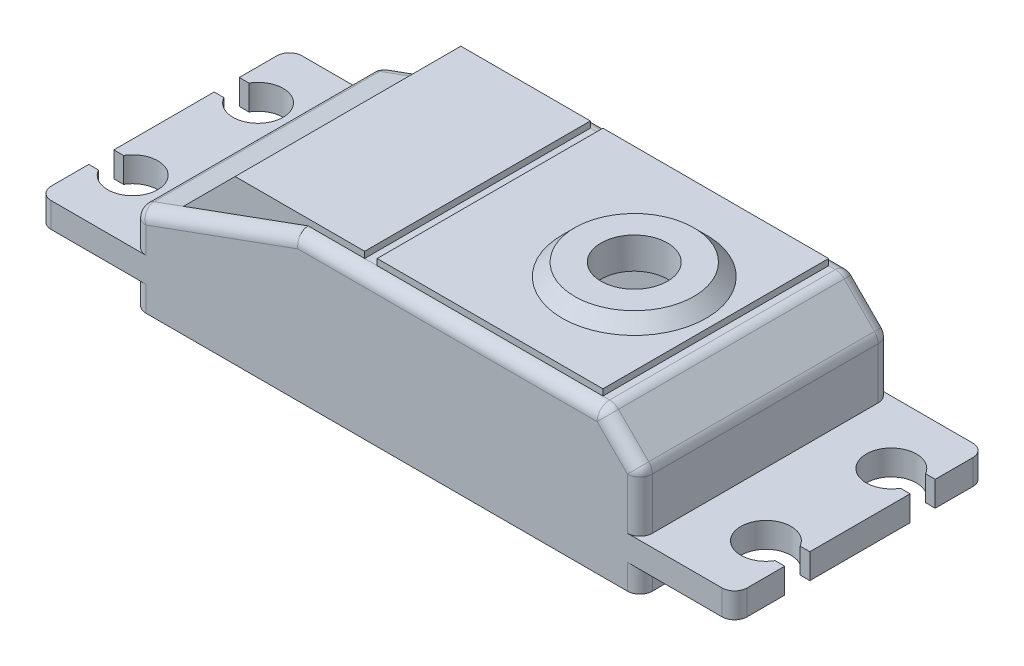
from build123d import *

# Parameters (mm, degrees)
ESQUISSE1_W              = 38.4
ESQUISSE1_H              = 18
BOSS_EXTRU_1_DEPTH       = 2
ESQUISSE2_W              = 40.4
ESQUISSE2_H              = 20
ESQUISSE2_W_2            = 38.4
ESQUISSE2_H_2            = 18
BOSS_EXTRU_2_DEPTH       = 2
EXTRU_MINCE1_DEPTH       = 10
EXTRU_MINCE1_DEPTH_BACK  = 10
BOSS_EXTRU_3_DEPTH       = 1
ESQUISSE6_R              = 2.65
ENL_V_MAT_EXTRU_1_DEPTH  = 41.929818
BOSS_EXTRU_7_START       = -9
BOSS_EXTRU_7_DEPTH       = 18
BOSS_EXTRU_7_2_OUTLINE_W = 18
BOSS_EXTRU_7_2_OUTLINE_H = 0.5
BOSS_EXTRU_7_2_DEPTH     = 6.350393
BOSS_EXTRU_7_START_2     = 2.65
BOSS_EXTRU_7_3_OUTLINE_W = 18
BOSS_EXTRU_7_3_OUTLINE_H = 0.5
BOSS_EXTRU_7_3_DEPTH     = 6.35
BOSS_EXTRU_7_START_3     = 9.5
BOSS_EXTRU_7_4_DEPTH     = 0.5
BOSS_EXTRU_7_5_DEPTH     = 0.5
CONG_1_R                 = 1
ENL_V_MAT_EXTRU_2_DEPTH  = 44.453999


with BuildPart() as part:
    # Esquisse1 → Boss.-Extru.1 (new body)
    with BuildSketch(Plane(origin=(0, 0, 0), x_dir=(1, 0, 0), z_dir=(0, 1, 0))):
        with BuildLine():
            Line((-37.5, 10), (18, 10))
            Line((18, 10), (18, 6))
            Line((18, 6), (17.232051, 6))
            ThreePointArc((17.232051, 6), (13.5, 5), (17.232051, 4))
            Line((17.232051, 4), (18, 4))
            Line((18, 4), (18, -4))
            Line((18, -4), (17.232051, -4))
            ThreePointArc((17.232051, -4), (13.5, -5), (17.232051, -6))
            Line((17.232051, -6), (18, -6))
            Line((18, -6), (18, -10))
            Line((18, -10), (-37.5, -10))
            Line((-37.5, -10), (-37.5, -6))
            Line((-37.5, -6), (-36.732051, -6))
            ThreePointArc((-36.732051, -6), (-33, -5), (-36.732051, -4))
            Line((-36.732051, -4), (-37.5, -4))
            Line((-37.5, -4), (-37.5, 4))
            Line((-37.5, 4), (-36.732051, 4))
            ThreePointArc((-36.732051, 4), (-33, 5), (-36.732051, 6))
            Line((-36.732051, 6), (-37.5, 6))
            Line((-37.5, 6), (-37.5, 10))
        make_face()
        with Locations((-9.75, 0)):
            Rectangle(ESQUISSE1_W, ESQUISSE1_H, mode=Mode.SUBTRACT)
    extrude(amount=BOSS_EXTRU_1_DEPTH)

    # Esquisse2 → Boss.-Extru.2 (add)
    with BuildSketch(Plane.XZ):
        with Locations((-9.75, 0)):
            Rectangle(ESQUISSE2_W, ESQUISSE2_H)
        with Locations((-9.75, 0)):
            Rectangle(ESQUISSE2_W_2, ESQUISSE2_H_2, mode=Mode.SUBTRACT)
    extrude(amount=BOSS_EXTRU_2_DEPTH)

    # Esquisse3 → Extru.-Mince1 (add, two sides: drawn at the far end of the back side and taken through both)
    with BuildSketch(Plane.XY.offset(-EXTRU_MINCE1_DEPTH_BACK)):
        Polygon((-29.95, 2), (-29.95, 4.786585), (-17, 9.5), (7.45, 9.5), (10.45, 6.5), (10.45, 2), (9.45, 2), (9.45, 6.085786), (7.035786, 8.5), (-16.823673, 8.5), (-28.95, 4.086378), (-28.95, 2), align=None)
    extrude(amount=EXTRU_MINCE1_DEPTH + EXTRU_MINCE1_DEPTH_BACK)

    # Esquisse4 → Boss.-Extru.3 (add)
    with BuildSketch(Plane.XY.offset(10)):
        Polygon((10.45, 6.5), (10.45, 2), (-29.95, 2), (-29.95, 4.786585), (-17, 9.5), (7.45, 9.5), align=None)
    boss_extru_3 = extrude(amount=-BOSS_EXTRU_3_DEPTH)

    # Symétrie1: Boss.-Extru.3 across plane
    add(boss_extru_3.mirror(Plane.XY))

    # Esquisse5 → Révolution1 (revolve)
    with BuildSketch(Plane.XY, mode=Mode.PRIVATE) as r_volution1_sk:
        Polygon((-6.25, 9.5), (-4.75, 11), (0, 11), (0, 10), (-4.335786, 10), (-5.542893, 8.792893), align=None)
    revolve(r_volution1_sk.sketch.rotate(Axis((0, 11, 0), (0, -1, 0)), 270), axis=Axis((0, 11, 0), (0, -1, 0)))

    # Esquisse6 → Enlèv. mat.-Extru.1 (cut, through all)
    with BuildSketch(Plane(origin=(0, 11, 0), x_dir=(1, 0, 0), z_dir=(0, 1, 0))):
        Circle(ESQUISSE6_R)
    extrude(amount=-ENL_V_MAT_EXTRU_1_DEPTH, mode=Mode.SUBTRACT)

    # Boss.-Extru.7: read off the stored shape, not the designer's step
    # Boss.-Extru.7 outline → Boss.-Extru.7 (add)
    with BuildSketch(Plane.XY.offset(BOSS_EXTRU_7_START)):
        Polygon((-12.5, 10), (-26.95, 10), (-26.95, 5.878496), (-17, 9.5), (-12.5, 9.5), align=None)
    extrude(amount=BOSS_EXTRU_7_DEPTH)

    # Boss.-Extru.7 2 outline → Boss.-Extru.7 2 (add)
    with BuildSketch(Plane.XY.offset(BOSS_EXTRU_7_START)):
        with Locations((-2.5, 9.75)):
            Rectangle(BOSS_EXTRU_7_2_OUTLINE_W, BOSS_EXTRU_7_2_OUTLINE_H)
    extrude(amount=BOSS_EXTRU_7_2_DEPTH)

    # Boss.-Extru.7 3 outline → Boss.-Extru.7 3 (add)
    with BuildSketch(Plane.XY.offset(BOSS_EXTRU_7_START_2)):
        with Locations((-2.5, 9.75)):
            Rectangle(BOSS_EXTRU_7_3_OUTLINE_W, BOSS_EXTRU_7_3_OUTLINE_H)
    extrude(amount=BOSS_EXTRU_7_3_DEPTH)

    # Boss.-Extru.7 4 outline → Boss.-Extru.7 4 (cut)
    with BuildSketch(Plane(origin=(0, 0, 0), x_dir=(1, 0, 0), z_dir=(0, 1, 0)).offset(BOSS_EXTRU_7_START_3)):
        with BuildLine():
            Line((-0.04562, 2.649607), (0.04562, 2.649607))
            ThreePointArc((0.04562, 2.649607), (0, 2.65), (-0.04562, 2.649607))
        make_face()
    extrude(amount=BOSS_EXTRU_7_4_DEPTH, mode=Mode.SUBTRACT)

    # Boss.-Extru.7 5 outline → Boss.-Extru.7 5 (add)
    with BuildSketch(Plane(origin=(0, 0, 0), x_dir=(1, 0, 0), z_dir=(0, 1, 0)).offset(BOSS_EXTRU_7_START_3)):
        with BuildLine():
            ThreePointArc((0.04562, 2.649607), (2.649902, -0.022811), (0, -2.65))
            Line((0, -2.65), (6.5, -2.65))
            Line((6.5, -2.65), (6.5, 2.649607))
            Line((6.5, 2.649607), (0.04562, 2.649607))
        make_face()
        with BuildLine():
            Line((-11.5, -2.65), (0, -2.65))
            ThreePointArc((0, -2.65), (-2.649902, -0.022811), (-0.04562, 2.649607))
            Line((-0.04562, 2.649607), (-11.5, 2.649607))
            Line((-11.5, 2.649607), (-11.5, -2.65))
        make_face()
    extrude(amount=BOSS_EXTRU_7_5_DEPTH)

    # Congé1
    cong_1_edges = [part.edges().sort_by_distance(p)[0] for p in [
        (-29.95, 4.786585, 0),
        (-23.475, 7.143293, -10),
        (-23.475, 7.143293, 10),
        (-4.775, 9.5, 10),
        (-4.775, 9.5, -10),
        (7.45, 9.5, 0),
        (10.45, 6.5, 0),
        (8.95, 8, 10),
        (8.95, 8, -10),
        (10.45, 4.25, 10),
        (10.45, 4.25, -10),
        (18, 1, -10),
        (18, 1, 10),
        (10.45, -1, 10),
        (-29.95, -1, 10),
        (-29.95, 3.393293, 10),
        (-29.95, 3.393293, -10),
        (-29.95, -1, -10),
        (-37.5, 1, -10),
        (-37.5, 1, 10),
        (10.45, -1, -10),
    ]]
    fillet(cong_1_edges, radius=CONG_1_R - 0.0001)  # a hair under: the kernel refuses the full size

    # Esquisse11 → Enlèv. mat.-Extru.2 (cut, through all)
    with BuildSketch(Plane(origin=(0, 0, -9), x_dir=(-1, 0, 0), z_dir=(0, 0, -1))):
        Polygon((26.95, 5.878496), (21.455546, 11.37295), (30.404027, 11.37295), align=None)
    extrude(amount=-ENL_V_MAT_EXTRU_2_DEPTH, mode=Mode.SUBTRACT)


solid = part.part
